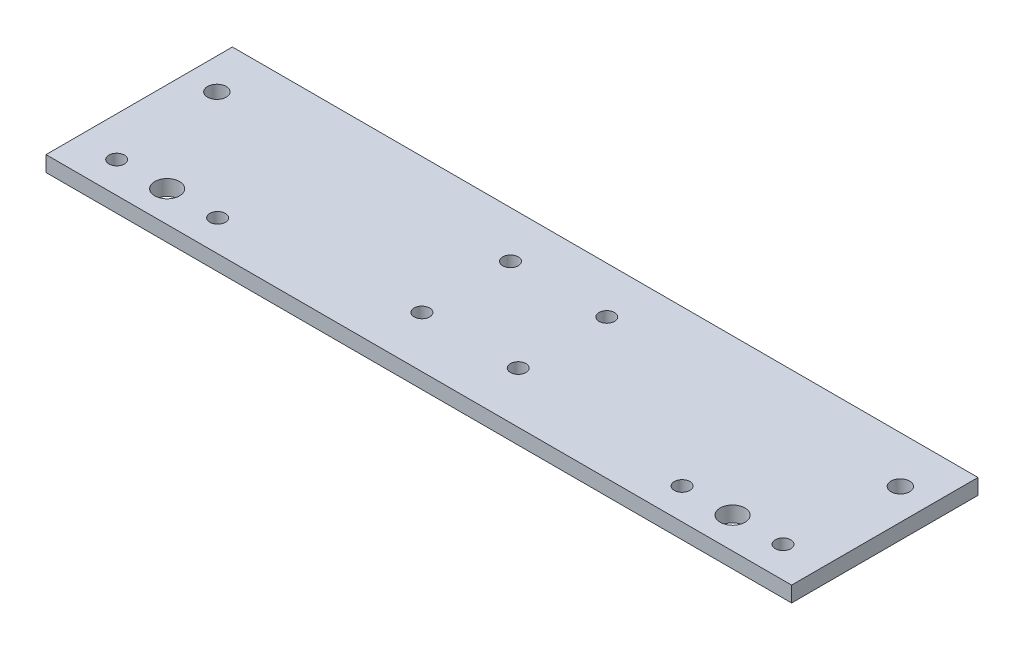
from build123d import *

# Parameters (mm, degrees)
SKETCH1_W           = 240
SKETCH1_H           = 60
SKETCH1_R           = 4
SKETCH1_R_2         = 3
SKETCH1_R_3         = 2.5
BOSS_EXTRUDE1_DEPTH = 5


with BuildPart() as part:
    # Sketch1 → Boss-Extrude1 (new body)
    with BuildSketch(Plane(origin=(0, 0, 0), x_dir=(1, 0, 0), z_dir=(0, 1, 0))):
        with Locations((0, -15.214636322)):
            Rectangle(SKETCH1_W, SKETCH1_H)
        with Locations((-91, -35.214636322)):
            Circle(SKETCH1_R, mode=Mode.SUBTRACT)
        with Locations((91, -35.214636322)):
            Circle(SKETCH1_R, mode=Mode.SUBTRACT)
        with Locations((-110, -0.214636322)):
            Circle(SKETCH1_R_2, mode=Mode.SUBTRACT)
        with Locations((110, -0.214636322)):
            Circle(SKETCH1_R_2, mode=Mode.SUBTRACT)
        with Locations((-74.75, -35.214636322)):
            Circle(SKETCH1_R_3, mode=Mode.SUBTRACT)
        with Locations((-107.25, -35.214636322)):
            Circle(SKETCH1_R_3, mode=Mode.SUBTRACT)
        with Locations((107.25, -35.214636322)):
            Circle(SKETCH1_R_3, mode=Mode.SUBTRACT)
        with Locations((74.75, -35.214636322)):
            Circle(SKETCH1_R_3, mode=Mode.SUBTRACT)
        with Locations((-15.5, -0.214636322)):
            Circle(SKETCH1_R_3, mode=Mode.SUBTRACT)
        with Locations((-15.5, -28.714636322)):
            Circle(SKETCH1_R_3, mode=Mode.SUBTRACT)
        with Locations((15.5, -0.214636322)):
            Circle(SKETCH1_R_3, mode=Mode.SUBTRACT)
        with Locations((15.5, -28.714636322)):
            Circle(SKETCH1_R_3, mode=Mode.SUBTRACT)
    extrude(amount=BOSS_EXTRUDE1_DEPTH)


solid = part.part
